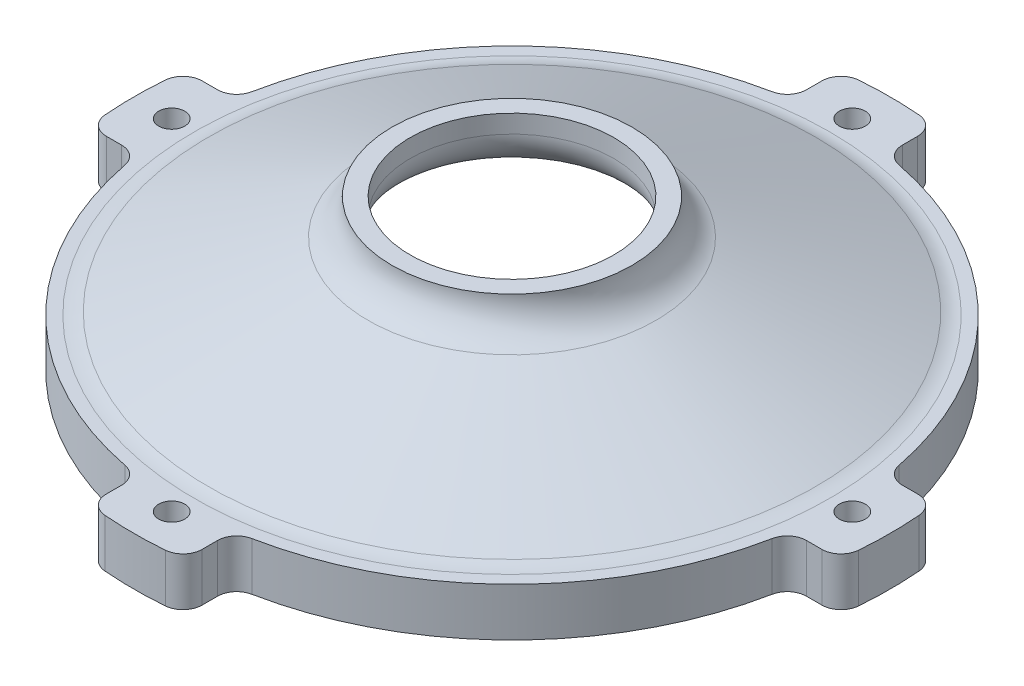
from build123d import *

# Parameters (mm, degrees)
F_18_0_1695_DIAMETER_HOLE1_D     = 4.3053
F_18_0_1695_DIAMETER_HOLE1_DEPTH = 38.1
F_18_0_1695_DIAMETER_HOLE1_TIP   = 1.293442612
CUT_EXTRUDE1_DEPTH               = 28


with BuildPart() as part:
    # Sketch2 → Revolve1 (revolve)
    with BuildSketch(Plane.XY):
        with BuildLine():
            Line((50, 0), (62.5, 0))
            Line((62.5, 0), (62.5, 7.982495649))
            Line((62.5, 7.982495649), (52.5, 7.982495649))
            ThreePointArc((52.5, 7.982495649), (51.285053929, 8.09980714), (50.114998295, 8.447407131))
            Line((50.114998295, 8.447407131), (23.792498295, 19.114911482))
            ThreePointArc((23.792498295, 19.114911482), (20.911227085, 21.451920296), (19.8275, 25))
            Line((19.8275, 25), (16.8275, 25))
            Line((16.8275, 25), (16.8275, 22))
            ThreePointArc((16.8275, 22), (17.911227085, 18.451920296), (20.792498295, 16.114911482))
            Line((20.792498295, 16.114911482), (46.035001705, 5.885088518))
            ThreePointArc((46.035001705, 5.885088518), (48.916272915, 3.548079704), (50, 0))
        make_face()
    revolve(axis=Axis((0, 0, 0), (0, 1, 0)))

    # #18 (0.1695) Diameter Hole1
    with Locations(Plane(origin=(0, 0, 0), x_dir=(-1, 0, 0), z_dir=(0, -1, 0))):
        with Locations((0, 56.25), (0, -56.25), (-56.25, 0), (56.25, 0)):
            Hole(F_18_0_1695_DIAMETER_HOLE1_D / 2, depth=F_18_0_1695_DIAMETER_HOLE1_DEPTH)
            with Locations((0, 0, -(F_18_0_1695_DIAMETER_HOLE1_DEPTH + F_18_0_1695_DIAMETER_HOLE1_TIP / 2))):  # 118° drill point
                Cone(0, F_18_0_1695_DIAMETER_HOLE1_D / 2, F_18_0_1695_DIAMETER_HOLE1_TIP, mode=Mode.SUBTRACT)

    # Sketch5 → Cut-Extrude1 (cut)
    with BuildSketch(Plane(origin=(0, 7.982495649, 0), x_dir=(1, 0, 0), z_dir=(0, 1, 0))):
        with BuildLine():
            Line((-56.597564395, 7.921), (-59.13485528, 7.921))
            ThreePointArc((-59.13485528, 7.921), (-61.28824505, 7.07913898), (-62.299678972, 5))
            ThreePointArc((-62.299678972, 5), (-44.194173824, 44.194173824), (-5, 62.299678972))
            ThreePointArc((-5, 62.299678972), (-7.07913898, 61.28824505), (-7.921, 59.13485528))
            Line((-7.921, 59.13485528), (-7.921, 56.597564395))
            ThreePointArc((-7.921, 56.597564395), (-8.64446813, 54.579988512), (-10.485166883, 53.48187801))
            ThreePointArc((-10.485166883, 53.48187801), (-38.537319575, 38.537319575), (-53.48187801, 10.485166883))
            ThreePointArc((-53.48187801, 10.485166883), (-54.579988512, 8.64446813), (-56.597564395, 7.921))
        make_face()
        with BuildLine():
            Line((7.921, 56.597564395), (7.921, 59.13485528))
            ThreePointArc((7.921, 59.13485528), (7.07913898, 61.28824505), (5, 62.299678972))
            ThreePointArc((5, 62.299678972), (44.194173824, 44.194173824), (62.299678972, 5))
            ThreePointArc((62.299678972, 5), (61.28824505, 7.07913898), (59.13485528, 7.921))
            Line((59.13485528, 7.921), (56.597564395, 7.921))
            ThreePointArc((56.597564395, 7.921), (54.579988512, 8.64446813), (53.48187801, 10.485166883))
            ThreePointArc((53.48187801, 10.485166883), (38.537319575, 38.537319575), (10.485166883, 53.48187801))
            ThreePointArc((10.485166883, 53.48187801), (8.64446813, 54.579988512), (7.921, 56.597564395))
        make_face()
        with BuildLine():
            Line((56.597564395, -7.921), (59.13485528, -7.921))
            ThreePointArc((59.13485528, -7.921), (61.28824505, -7.07913898), (62.299678972, -5))
            ThreePointArc((62.299678972, -5), (44.194173824, -44.194173824), (5, -62.299678972))
            ThreePointArc((5, -62.299678972), (7.07913898, -61.28824505), (7.921, -59.13485528))
            Line((7.921, -59.13485528), (7.921, -56.597564395))
            ThreePointArc((7.921, -56.597564395), (8.64446813, -54.579988512), (10.485166883, -53.48187801))
            ThreePointArc((10.485166883, -53.48187801), (38.537319575, -38.537319575), (53.48187801, -10.485166883))
            ThreePointArc((53.48187801, -10.485166883), (54.579988512, -8.64446813), (56.597564395, -7.921))
        make_face()
        with BuildLine():
            Line((-7.921, -56.597564395), (-7.921, -59.13485528))
            ThreePointArc((-7.921, -59.13485528), (-7.07913898, -61.28824505), (-5, -62.299678972))
            ThreePointArc((-5, -62.299678972), (-44.194173824, -44.194173824), (-62.299678972, -5))
            ThreePointArc((-62.299678972, -5), (-61.28824505, -7.07913898), (-59.13485528, -7.921))
            Line((-59.13485528, -7.921), (-56.597564395, -7.921))
            ThreePointArc((-56.597564395, -7.921), (-54.579988512, -8.64446813), (-53.48187801, -10.485166883))
            ThreePointArc((-53.48187801, -10.485166883), (-38.537319575, -38.537319575), (-10.485166883, -53.48187801))
            ThreePointArc((-10.485166883, -53.48187801), (-8.64446813, -54.579988512), (-7.921, -56.597564395))
        make_face()
    extrude(amount=-CUT_EXTRUDE1_DEPTH, mode=Mode.SUBTRACT)


solid = part.part
